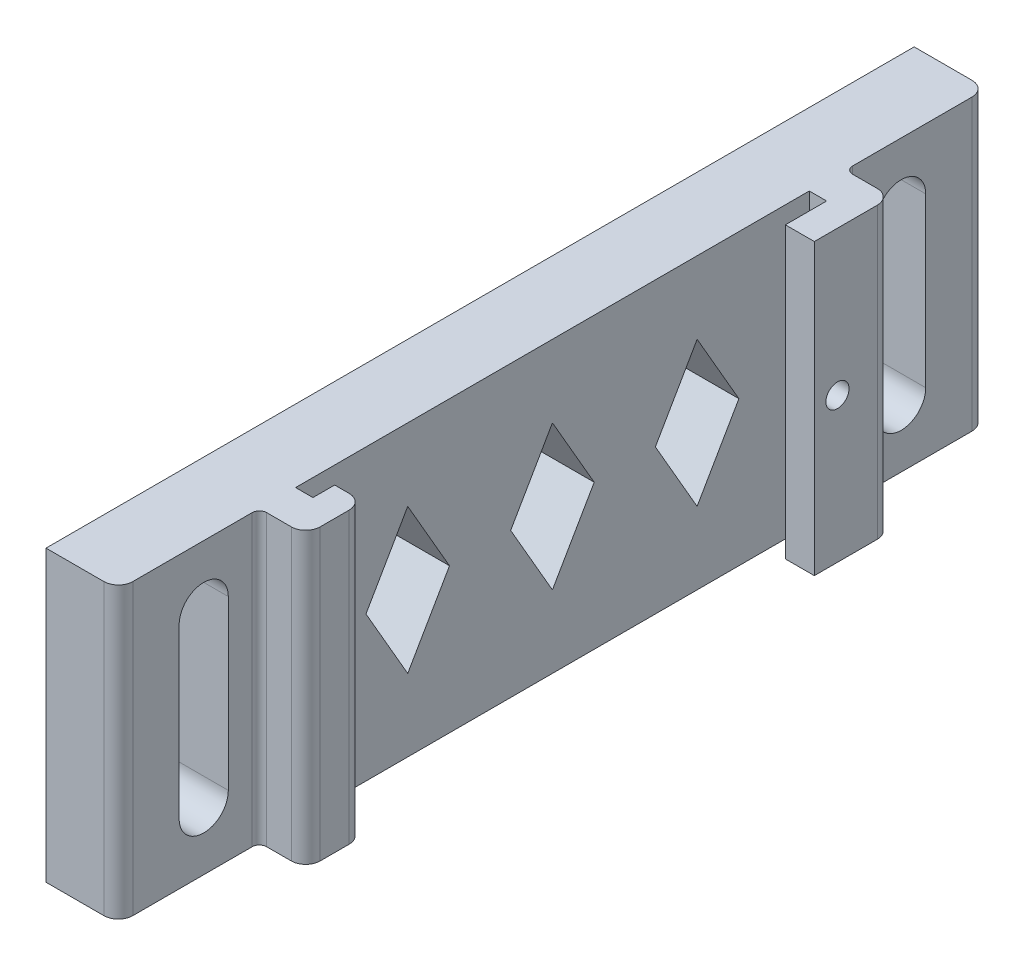
from build123d import *

# Parameters (mm, degrees)
BOSS_EXTRUDE1_DEPTH       = 20
M3_CLEARANCE_SLOT1_DEPTH  = 8.2
SKETCH5_W                 = 3.2
SKETCH5_H                 = 9.75
CUT_EXTRUDE1_DEPTH        = 37.976208567
CUT_EXTRUDE2_DEPTH        = 37.400549446
LPATTERN1_COUNT           = 2
LPATTERN1_PITCH           = 10
LPATTERN2_COUNT           = 2
LPATTERN2_PITCH           = 10
FILLET2_R                 = 0.5
SKETCH9_W                 = 2
SKETCH9_H                 = 20
BOSS_EXTRUDE2_DEPTH       = 1.35
FILLET1_R                 = 1
M2X0_4_TAPPED_HOLE1_D     = 1.6
M2X0_4_TAPPED_HOLE1_DEPTH = 2


# Read off the part's stored shape, not the designer's step: M3 Clearance Slot1
with BuildPart() as part:
    # Sketch2 → Boss-Extrude1 (new body)
    with BuildSketch(Plane(origin=(0, 0, 0), x_dir=(1, 0, 0), z_dir=(0, 1, 0))):
        Polygon((0, -30), (0, 30), (8.2, 30), (8.2, 16.25), (6.2, 16.25), (6.2, 17.75), (5, 17.75), (5, -17.75), (6.2, -17.75), (6.2, -16.25), (8.2, -16.25), (8.2, -30), align=None)
    extrude(amount=BOSS_EXTRUDE1_DEPTH)

    # M3 Clearance Slot1 outline → M3 Clearance Slot1 (cut)
    with BuildSketch(Plane.YZ):
        with BuildLine():
            ThreePointArc((15.8, 22.4), (17.5, 24.1), (15.8, 25.8))
            Line((15.8, 25.8), (4.2, 25.8))
            ThreePointArc((4.2, 25.8), (2.5, 24.1), (4.2, 22.4))
            Line((4.2, 22.4), (15.8, 22.4))
        make_face()
        with BuildLine():
            ThreePointArc((15.8, -25.8), (17.5, -24.1), (15.8, -22.4))
            Line((15.8, -22.4), (4.2, -22.4))
            ThreePointArc((4.2, -22.4), (2.5, -24.1), (4.2, -25.8))
            Line((4.2, -25.8), (15.8, -25.8))
        make_face()
    extrude(amount=M3_CLEARANCE_SLOT1_DEPTH, mode=Mode.SUBTRACT)

    # Sketch5 → Cut-Extrude1 (cut, through all)
    with BuildSketch(Plane.XZ):
        with Locations((6.6, 25.125)):
            Rectangle(SKETCH5_W, SKETCH5_H)
        with Locations((6.6, -25.125)):
            Rectangle(SKETCH5_W, SKETCH5_H)
    extrude(amount=-CUT_EXTRUDE1_DEPTH, mode=Mode.SUBTRACT)

    # Sketch8 → Cut-Extrude2 (cut, through all)
    with BuildSketch(Plane(origin=(5, 0, 0), x_dir=(0, 0, -1), z_dir=(1, 0, 0))):
        Polygon((0, 5), (2.886751346, 10), (0, 15), (-2.886751346, 10), align=None)
    cut_extrude2 = extrude(amount=-CUT_EXTRUDE2_DEPTH, mode=Mode.SUBTRACT)

    # LPattern1: Cut-Extrude2 ×2
    with Locations(*[(0, 0, i * LPATTERN1_PITCH) for i in range(1, LPATTERN1_COUNT)]):
        add(cut_extrude2, mode=Mode.SUBTRACT)

    # LPattern2: Cut-Extrude2 ×2
    with Locations(*[(0, 0, -i * LPATTERN2_PITCH) for i in range(1, LPATTERN2_COUNT)]):
        add(cut_extrude2, mode=Mode.SUBTRACT)

    # Fillet2
    fillet2_edges = [part.edges().sort_by_distance(p)[0] for p in [
        (5, 10, 20.25),
        (5, 10, -20.25),
    ]]
    fillet(fillet2_edges, radius=FILLET2_R)

    # Sketch9 → Boss-Extrude2 (add)
    with BuildSketch(Plane.XY.offset(-16.25)):
        with Locations((7.2, 10)):
            Rectangle(SKETCH9_W, SKETCH9_H)
    extrude(amount=BOSS_EXTRUDE2_DEPTH)

    # Fillet1
    fillet1_edges = [part.edges().sort_by_distance(p)[0] for p in [
        (8.2, 10, 16.25),
        (8.2, 10, 20.25),
        (5, 10, 30),
        (8.2, 10, -20.25),
        (5, 10, -30),
    ]]
    fillet(fillet1_edges, radius=FILLET1_R)

    # M2x0.4 Tapped Hole1
    with Locations(Plane(origin=(8.2, 0, 0), x_dir=(0, 0, -1), z_dir=(1, 0, 0))):
        with Locations((16.5, 10)):
            Hole(M2X0_4_TAPPED_HOLE1_D / 2, depth=M2X0_4_TAPPED_HOLE1_DEPTH)


solid = part.part
